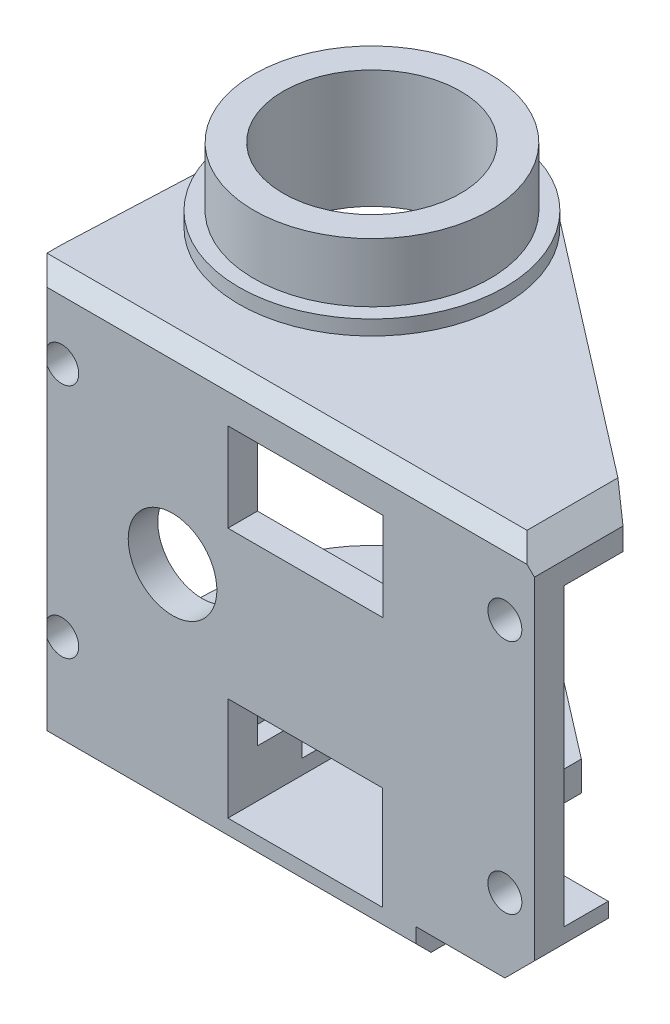
from build123d import *
from build123d.topology import SkipClean

# Parameters (mm, degrees)
SKETCH_1_W               = 34
SKETCH_1_H               = 22
EXTRUDE_1_DEPTH          = 1
SKETCH_3_R               = 9
SKETCH_3_R_2             = 6
EXTRUDE_3_DEPTH          = 4
SKETCH_4_R               = 7.99
SKETCH_4_R_2             = 6
EXTRUDE_4_DEPTH          = 4
EXTRUDE_5_DEPTH          = 3
CUT_EXTRUDE_START        = -3
SKETCH_6_R               = 6
CUT_EXTRUDE_1_DEPTH      = 3
MIRROR_START             = -14
MIRROR_9_OUTLINE_R       = 6
MIRROR_9_DEPTH           = 3
EXTRUDE_START            = 1
SKETCH_7_R               = 9
SKETCH_7_R_2             = 6
EXTRUDE_6_DEPTH          = 1
EXTRUDE_START_2          = 1.9
SKETCH_8_R               = 7.99
EXTRUDE_7_DEPTH          = 1.9
EXTRUDE_START_3          = -5.9
SKETCH_9_R               = 6
EXTRUDE_8_DEPTH          = 5.9
SKETCH_10_R              = 3
CUT_EXTRUDE_2_DEPTH      = 10
CUT_EXTRUDE_3_REACH      = 47.167
SKETCH_11_R              = 1.15
PATTERN_CIRCULAR_1_COUNT = 4
SKETCH_12_R              = 2
CUT_EXTRUDE_4_DEPTH      = 2.5
PATTERN_CIRCULAR_2_COUNT = 4
CUT_EXTRUDE_5_DEPTH      = 41.635575547
CHAMFER_1_SIZE           = 1.5
SKETCH_15_W              = 8
SKETCH_15_H              = 2
CUT_EXTRUDE_8_DEPTH      = 10
EXTRUDE_9_DEPTH          = 3
SKETCH_17_W              = 8.5
SKETCH_17_H              = 21.138622828
CUT_EXTRUDE_9_DEPTH      = 1
SKETCH_18_W              = 10.48
SKETCH_18_H              = 7
SKETCH_18_W_2            = 10.5
SKETCH_18_H_2            = 6
CUT_EXTRUDE_10_DEPTH     = 33.714675606
CHAMFER_2_SIZE           = 2
SKETCH_19_R              = 3
CUT_EXTRUDE_11_DEPTH     = 33.714675606
SKETCH_20_R              = 1.15
CUT_EXTRUDE_12_DEPTH     = 33.714675606
SKETCH_23_W              = 1.26
SKETCH_23_H              = 2
SKETCH_23_H_2            = 2.235993873
EXTRUDE_10_DEPTH         = 3
CUT_EXTRUDE_14_DEPTH     = 43.898135158
CHAMFER_3_SIZE           = 1


# Read off the part's stored shape, not the designer's step: 镜向9
with BuildPart() as part:
    # 草图1 → 凸台-拉伸1 (new, symmetric)
    with BuildSketch(Plane.XY):
        Rectangle(SKETCH_1_W, SKETCH_1_H)
    extrude(amount=EXTRUDE_1_DEPTH, both=True)



with BuildPart() as body_2:
    # 草图3 → 凸台-拉伸3 (new body)
    with BuildSketch(Plane(origin=(0, 11, 0), x_dir=(1, 0, 0), z_dir=(0, 1, 0))):
        with Locations(Location((-7.5, 12.5, 0), (0, 0, 180))):
            Circle(SKETCH_3_R)
        with Locations(Location((-7.5, 12.5, 0), (0, 0, 180))):
            Circle(SKETCH_3_R_2, mode=Mode.SUBTRACT)
    extrude(amount=EXTRUDE_3_DEPTH)

    # 草图4 → 凸台-拉伸4 (add)
    with BuildSketch(Plane(origin=(0, 15, 0), x_dir=(1, 0, 0), z_dir=(0, 1, 0))):
        with Locations(Location((-7.5, 12.5, 0), (0, 0, 180))):
            Circle(SKETCH_4_R)
        with Locations(Location((-7.5, 12.5, 0), (0, 0, 180))):
            Circle(SKETCH_4_R_2, mode=Mode.SUBTRACT)
    extrude(amount=EXTRUDE_4_DEPTH)


with BuildPart() as part_1:
    add(part.part)

    add(body_2.part)  # 凸台-拉伸5 merges body 2
    # 草图5 → 凸台-拉伸5 (add)
    with BuildSketch(Plane(origin=(0, 11, 0), x_dir=(1, 0, 0), z_dir=(0, 1, 0))):
        with BuildLine():
            Line((17, -1), (17, 5))
            Line((17, 5), (-2.010591436, 19.632067976))
            ThreePointArc((-2.010591436, 19.632067976), (-11.47462721, 20.574796501), (-16.5, 12.5))
            Line((-16.5, 12.5), (-17, 1))
            Line((-17, 1), (-17, -1))
            Line((-17, -1), (17, -1))
        make_face()
    extrude(amount=EXTRUDE_5_DEPTH)

    # 草图6 → 切除-拉伸1 (cut)
    with BuildSketch(Plane(origin=(0, 14, 0), x_dir=(1, 0, 0), z_dir=(0, 1, 0)).offset(CUT_EXTRUDE_START)):
        with Locations(Location((-7.5, 12.5, 0), (0, 0, 180))):
            Circle(SKETCH_6_R)
    extrude(amount=CUT_EXTRUDE_1_DEPTH, mode=Mode.SUBTRACT)

    # 镜向9 outline → 镜向9 (add)
    with BuildSketch(Plane(origin=(0, 0, 0), x_dir=(1, 0, 0), z_dir=(0, 1, 0)).offset(MIRROR_START)):
        with BuildLine():
            Line((-17, 1), (-17, -1))
            Line((-17, -1), (17, -1))
            Line((17, -1), (17, 5))
            Line((17, 5), (-2.010591436, 19.632067976))
            ThreePointArc((-2.010591436, 19.632067976), (-11.47462721, 20.574796501), (-16.5, 12.5))
            Line((-16.5, 12.5), (-17, 1))
        make_face()
        with Locations((-7.5, 12.5)):
            Circle(MIRROR_9_OUTLINE_R, mode=Mode.SUBTRACT)
    extrude(amount=MIRROR_9_DEPTH)

    # 草图7 → 凸台-拉伸6 (add)
    with SkipClean():  # the faces are left unmerged after this step: merging them gives an invalid solid
        with BuildSketch(Plane.XZ.offset(14).offset(EXTRUDE_START)):
            with Locations(Location((-7.5, -12.5, 0), (0, 0, 180))):
                Circle(SKETCH_7_R)
            with Locations(Location((-7.5, -12.5, 0), (0, 0, 180))):
                Circle(SKETCH_7_R_2, mode=Mode.SUBTRACT)
        extrude(amount=-EXTRUDE_6_DEPTH)

    # 草图8 → 凸台-拉伸7 (add)
    with SkipClean():  # the faces are left unmerged after this step: merging them gives an invalid solid
        with BuildSketch(Plane.XZ.offset(15).offset(EXTRUDE_START_2)):
            with Locations(Location((-7.5, -12.5, 0), (0, 0, 180))):
                Circle(SKETCH_8_R)
        extrude(amount=-EXTRUDE_7_DEPTH)

    # 草图9 → 凸台-拉伸8 (add)
    with BuildSketch(Plane(origin=(0, -11, 0), x_dir=(1, 0, 0), z_dir=(0, 1, 0)).offset(EXTRUDE_START_3)):
        with Locations(Location((-7.5, 12.5, 0), (0, 0, 180))):
            Circle(SKETCH_9_R)
    extrude(amount=EXTRUDE_8_DEPTH)

    # 草图10 → 切除-拉伸2 (cut)
    with BuildSketch(Plane.XZ.offset(16.9)):
        with Locations((-7.5, -12.5)):
            Circle(SKETCH_10_R)
    extrude(amount=-CUT_EXTRUDE_2_DEPTH, mode=Mode.SUBTRACT)

    # 草图11 → 切除-拉伸3 (cut, up to next)
    with BuildSketch(Plane.XZ.offset(16.9), mode=Mode.PRIVATE) as cut_extrude_3_sk1:
        with Locations((-7.5, -18.5)):
            Circle(SKETCH_11_R)
    cut_extrude_3_tool1 = extrude(cut_extrude_3_sk1.sketch, amount=-CUT_EXTRUDE_3_REACH, mode=Mode.PRIVATE) & part_1.part
    cut_extrude_3 = cut_extrude_3_tool1.solids().sort_by_distance((-7.5, -16.9, -18.5))[0]
    add(cut_extrude_3, mode=Mode.SUBTRACT)

    # 阵列(圆周)1: 切除-拉伸3 ×4 about axis
    pattern_circular_1_axis = Axis((-7.5, 0, -12.5), (0, 1, 0))
    for i in range(1, PATTERN_CIRCULAR_1_COUNT):
        add(cut_extrude_3.rotate(pattern_circular_1_axis, i * 360 / PATTERN_CIRCULAR_1_COUNT), mode=Mode.SUBTRACT)

    # 草图12 → 切除-拉伸4 (cut)
    with BuildSketch(Plane(origin=(0, -11, 0), x_dir=(1, 0, 0), z_dir=(0, 1, 0))):
        with Locations(Location((-7.5, 18.5, 0), (0, 0, 180))):
            Circle(SKETCH_12_R)
    cut_extrude_4 = extrude(amount=-CUT_EXTRUDE_4_DEPTH, mode=Mode.SUBTRACT)

    # 阵列(圆周)2: 切除-拉伸4 ×4 about axis
    pattern_circular_2_axis = Axis((-7.5, 0, -12.5), (0, 1, 0))
    for i in range(1, PATTERN_CIRCULAR_2_COUNT):
        add(cut_extrude_4.rotate(pattern_circular_2_axis, i * 360 / PATTERN_CIRCULAR_2_COUNT), mode=Mode.SUBTRACT)

    # 草图14 → 切除-拉伸5 (cut, through all)
    with BuildSketch(Plane(origin=(0, -11, 0), x_dir=(1, 0, 0), z_dir=(0, 1, 0))):
        Polygon((17, 5), (4.75, 14.428577397), (4.75, 1), (17, 1), align=None)
    extrude(amount=-CUT_EXTRUDE_5_DEPTH, mode=Mode.SUBTRACT)

    # 倒角1
    chamfer_1_edges = [part_1.edges().sort_by_distance(p)[0] for p in [
        (17, 14, -2),
    ]]
    chamfer(chamfer_1_edges, length=CHAMFER_1_SIZE)

    # 草图15 → 切除-拉伸8 (cut)
    with BuildSketch(Plane(origin=(0, 0, -1), x_dir=(-1, 0, 0), z_dir=(0, 0, -1))):
        with Locations((-13, -13)):
            Rectangle(SKETCH_15_W, SKETCH_15_H)
    extrude(amount=-CUT_EXTRUDE_8_DEPTH, mode=Mode.SUBTRACT)

    # 草图16 → 凸台-拉伸9 (add)
    with BuildSketch(Plane(origin=(0, 0, -1), x_dir=(-1, 0, 0), z_dir=(0, 0, -1))):
        Polygon((-17, -9), (-6.73, -9), (-6.73, -14), (-9, -14), (-9, -12), (-17, -12), align=None)
    extrude(amount=EXTRUDE_9_DEPTH)

    # 草图17 → 切除-拉伸9 (cut)
    with BuildSketch(Plane(origin=(0, -11, 0), x_dir=(1, 0, 0), z_dir=(0, 1, 0))):
        with Locations((0.5, 11.569311414)):
            Rectangle(SKETCH_17_W, SKETCH_17_H)
    extrude(amount=-CUT_EXTRUDE_9_DEPTH, mode=Mode.SUBTRACT)

    # 草图18 → 切除-拉伸10 (cut, through all)
    with BuildSketch(Plane(origin=(0, 0, -1), x_dir=(-1, 0, 0), z_dir=(0, 0, -1))):
        with Locations((-1.49, -8.5)):
            Rectangle(SKETCH_18_W, SKETCH_18_H)
        with Locations((-1.5, 8)):
            Rectangle(SKETCH_18_W_2, SKETCH_18_H_2)
    extrude(amount=-CUT_EXTRUDE_10_DEPTH, mode=Mode.SUBTRACT)

    # 倒角2
    chamfer_2_edges = [part_1.edges().sort_by_distance(p)[0] for p in [
        (17, -12, -1.5),
    ]]
    chamfer(chamfer_2_edges, length=CHAMFER_2_SIZE)

    # 草图19 → 切除-拉伸11 (cut, through all)
    with BuildSketch(Plane(origin=(0, 0, -1), x_dir=(-1, 0, 0), z_dir=(0, 0, -1))):
        with Locations((7.5, 1)):
            Circle(SKETCH_19_R)
    extrude(amount=-CUT_EXTRUDE_11_DEPTH, mode=Mode.SUBTRACT)

    # 草图20 → 切除-拉伸12 (cut, through all)
    with BuildSketch(Plane(origin=(0, 0, -1), x_dir=(-1, 0, 0), z_dir=(0, 0, -1))):
        with Locations((15, 9)):
            Circle(SKETCH_20_R)
        with Locations((-15, 9)):
            Circle(SKETCH_20_R)
        with Locations((-15, -7)):
            Circle(SKETCH_20_R)
        with Locations((15, -7)):
            Circle(SKETCH_20_R)
    extrude(amount=-CUT_EXTRUDE_12_DEPTH, mode=Mode.SUBTRACT)

    # 草图23 → 凸台-拉伸10 (add)
    with BuildSketch(Plane(origin=(0, 0, -1), x_dir=(-1, 0, 0), z_dir=(0, 0, -1))):
        with Locations((16.37, -10)):
            Rectangle(SKETCH_23_W, SKETCH_23_H)
        with Locations((4.38, -9.882003064)):
            Rectangle(SKETCH_23_W, SKETCH_23_H_2)
    extrude(amount=EXTRUDE_10_DEPTH)

    # 草图24 → 切除-拉伸14 (cut, through all)
    with BuildSketch(Plane.XZ.offset(14)):
        Polygon((-17, -1), (-16.869565217, -4), (-17, -4), align=None)
    extrude(amount=-CUT_EXTRUDE_14_DEPTH, mode=Mode.SUBTRACT)

    # 倒角3
    # the kernel refuses this chamfer: 1 mm, written as the material it takes off along each edge
    with BuildSketch(Plane(origin=(-19.571682988, 14, 1), x_dir=(0, -0.9996219169112968, 0.027495876610586296), z_dir=(1, 0, 0))) as chamfer_3_piece_1:
        Polygon((CHAMFER_3_SIZE * 0.999621916911, CHAMFER_3_SIZE * 0.0274958766106), (-CHAMFER_3_SIZE * 0.0274958766106, CHAMFER_3_SIZE * 0.999621916911), (0, 0), align=None)
    extrude(amount=37.643365976, mode=Mode.SUBTRACT)
    with BuildSketch(Plane(origin=(-19.571682988, -14, 1), x_dir=(0, 0.9996219169112968, 0.027495876610586296), z_dir=(1, 0, 0))) as chamfer_3_piece_2:
        Polygon((CHAMFER_3_SIZE * 0.999621916911, -CHAMFER_3_SIZE * 0.0274958766106), (-CHAMFER_3_SIZE * 0.0274958766106, -CHAMFER_3_SIZE * 0.999621916911), (0, 0), align=None)
    extrude(amount=31.143365976, mode=Mode.SUBTRACT)
    with BuildSketch(Plane(origin=(-17, -16.571682988, 1), x_dir=(0.9996219169112968, 0, 0.027495876610586296), z_dir=(0, 1, 0))) as chamfer_3_piece_3:
        Polygon((CHAMFER_3_SIZE * 0.999621916911, CHAMFER_3_SIZE * 0.0274958766106), (-CHAMFER_3_SIZE * 0.0274958766106, CHAMFER_3_SIZE * 0.999621916911), (0, 0), align=None)
    extrude(amount=33.143365976, mode=Mode.SUBTRACT)


solid = part_1.part
